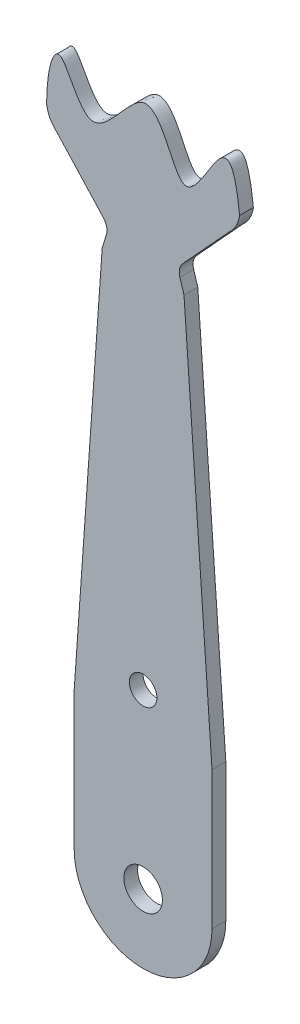
from build123d import *

# Parameters (mm, degrees)
MODEL_R           = 1
MODEL_R_2         = 1.4
BRIDA_BASE1_DEPTH = 1


# Sheet-metal steps are written as plain solids
with BuildPart() as part:
    # Model → Brida base1 (new body)
    with BuildSketch(Plane.XY):
        with BuildLine():
            Line((48.075555852, 24.960081428), (51.440287205, 28.631015815))
            ThreePointArc((51.440287205, 28.631015815), (51.952141408, 29.270754129), (52.2059904, 30.049740987))
            add(Edge.make_bspline(
                [(52.2059904, 30.049740987), (51.410853999, 37.450521911), (48.548934386, 24.427843185), (45.953129078, 36.745083032), (41.297938997, 28.004810972), (39.079853451, 35.722098329), (38.203024341, 32.104474877), (38.2059904, 30.049740987)],
                knots=[0, 0, 0, 0, 0.352722743, 0.547893705, 0.704624908, 0.854467765, 1, 1, 1, 1], degree=3))
            ThreePointArc((38.2059904, 30.049740987), (38.459839392, 29.270754129), (38.971693595, 28.631015815))
            Line((38.971693595, 28.631015815), (42.336424948, 24.960081428))
            ThreePointArc((42.336424948, 24.960081428), (42.562673339, 24.508023196), (42.538911562, 24.0030674))
            Line((42.538911562, 24.0030674), (42.240856149, 23.048171958))
            Line((42.240856149, 23.048171958), (40.2059904, -5.7615616))
            Line((40.2059904, -5.7615616), (40.2059904, -15.7615616))
            ThreePointArc((40.2059904, -15.7615616), (45.2059904, -20.7615616), (50.2059904, -15.7615616))
            Line((50.2059904, -15.7615616), (50.2059904, -5.7615616))
            Line((50.2059904, -5.7615616), (48.171124651, 23.048171958))
            Line((48.171124651, 23.048171958), (47.873069238, 24.0030674))
            ThreePointArc((47.873069238, 24.0030674), (47.849307461, 24.508023196), (48.075555852, 24.960081428))
        make_face()
        with Locations((45.2059904, -3.2615616)):
            Circle(MODEL_R, mode=Mode.SUBTRACT)
        with Locations((45.2059904, -15.7615616)):
            Circle(MODEL_R_2, mode=Mode.SUBTRACT)
    extrude(amount=-BRIDA_BASE1_DEPTH)


solid = part.part
